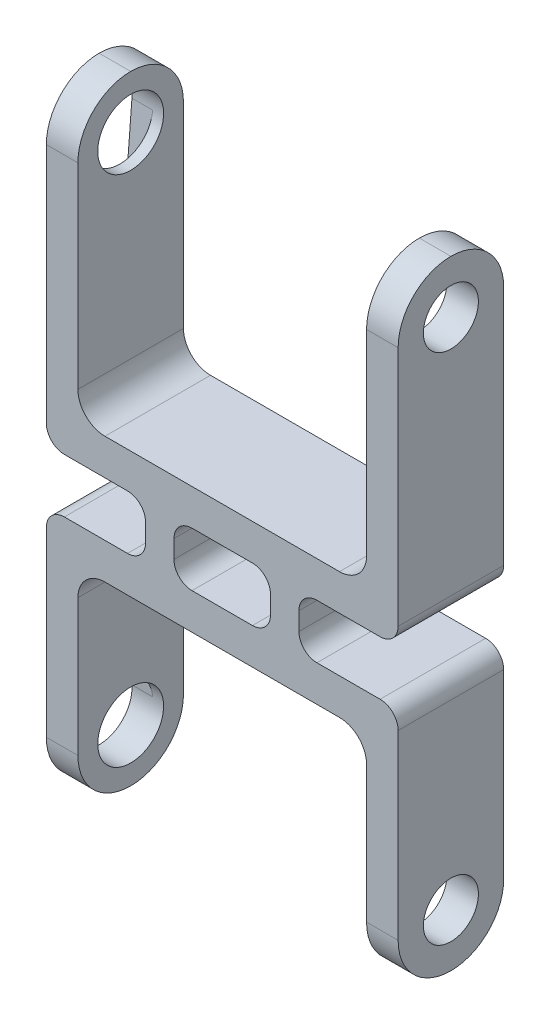
from build123d import *

# Parameters (mm, degrees)
SKETCH_1_W          = 10.7
SKETCH_1_H          = 6
EXTRUDE_1_DEPTH     = 11.7
SKETCH_2_R          = 3.65
CUT_EXTRUDE_1_DEPTH = 18.7
CUT_EXTRUDE_2_DEPTH = 2.3
SKETCH_2_4_R        = 3.65
CUT_EXTRUDE_3_DEPTH = 15.3
CUT_EXTRUDE_4_DEPTH = 2.3
FILLET_1_R          = 2
FILLET_2_R          = 2
FILLET_3_R          = 2
FILLET_4_R          = 2
FILLET_5_R          = 5.85
FILLET_6_R          = 5.85
FILLET_7_R          = 5.85
FILLET_8_R          = 5.85
FILLET_9_R          = 5.85
FILLET_10_R         = 5.85
FILLET_11_R         = 5.85
FILLET_12_R         = 5.85
FILLET_13_R         = 2
FILLET_14_R         = 2
FILLET_15_R         = 2
FILLET_16_R         = 2
FILLET_17_R         = 2
FILLET_18_R         = 2
FILLET_19_R         = 2
FILLET_20_R         = 2
SKETCH_3_R          = 3.05
CUT_EXTRUDE_5_DEPTH = 10
FILLET_21_R         = 3
FILLET_22_R         = 3
FILLET_23_R         = 3
FILLET_24_R         = 3


with BuildPart() as part:
    # 草图1 → 凸台-拉伸1 (new body)
    with BuildSketch(Plane.XY):
        Polygon((0, 0), (0, -28), (3.5, -28), (3.5, -4), (35.5, -4), (35.5, -28), (39, -28), (39, 0), (28, 0), (28, 6), (39, 6), (39, 40.6), (35.5, 40.6), (35.5, 10), (3.5, 10), (3.5, 40.6), (0, 40.6), (0, 6), (11, 6), (11, 0), align=None)
        with Locations((19.5, 3)):
            Rectangle(SKETCH_1_W, SKETCH_1_H, mode=Mode.SUBTRACT)
    extrude(amount=EXTRUDE_1_DEPTH)

    # 草图2 → 切除-拉伸1 (cut)
    with BuildSketch(Plane.ZY):
        with Locations(Location((5.85, -22.15, 0), (0, 0, 270))):
            Circle(SKETCH_2_R)
    extrude(amount=-CUT_EXTRUDE_1_DEPTH, mode=Mode.SUBTRACT)

    # 草图2<3> → 切除-拉伸2 (cut)
    with BuildSketch(Plane.ZY):
        with BuildLine():
            ThreePointArc((8.242618438, -6.011912226), (5.85, -3.8), (3.457381562, -6.011912226))
            Line((3.457381562, -6.011912226), (2.211226126, -21.863949843))
            ThreePointArc((2.211226126, -21.863949843), (5.85, -18.5), (9.488773874, -21.863949843))
            Line((9.488773874, -21.863949843), (8.242618438, -6.011912226))
        make_face()
    extrude(amount=-CUT_EXTRUDE_2_DEPTH, mode=Mode.SUBTRACT)

    # 草图2<4> → 切除-拉伸3 (cut)
    with BuildSketch(Plane.ZY):
        with Locations(Location((5.85, 34.75, 0), (0, 0, 270))):
            Circle(SKETCH_2_4_R)
    extrude(amount=-CUT_EXTRUDE_3_DEPTH, mode=Mode.SUBTRACT)

    # 草图2<5> → 切除-拉伸4 (cut)
    with BuildSketch(Plane.ZY):
        with BuildLine():
            Line((2.211226126, 34.463949843), (3.457381562, 18.611912226))
            ThreePointArc((3.457381562, 18.611912226), (5.85, 16.4), (8.242618438, 18.611912226))
            Line((8.242618438, 18.611912226), (9.488773874, 34.463949843))
            ThreePointArc((9.488773874, 34.463949843), (5.85, 31.1), (2.211226126, 34.463949843))
        make_face()
    extrude(amount=-CUT_EXTRUDE_4_DEPTH, mode=Mode.SUBTRACT)

    # 圆角1
    fillet_1_edges = [part.edges().sort_by_distance(p)[0] for p in [
        (0, 6, 5.85),
    ]]
    fillet(fillet_1_edges, radius=FILLET_1_R)

    # 圆角2
    fillet_2_edges = [part.edges().sort_by_distance(p)[0] for p in [
        (39, 6, 5.85),
    ]]
    fillet(fillet_2_edges, radius=FILLET_2_R)

    # 圆角3
    fillet_3_edges = [part.edges().sort_by_distance(p)[0] for p in [
        (39, 0, 5.85),
    ]]
    fillet(fillet_3_edges, radius=FILLET_3_R)

    # 圆角4
    fillet_4_edges = [part.edges().sort_by_distance(p)[0] for p in [
        (0, 0, 5.85),
    ]]
    fillet(fillet_4_edges, radius=FILLET_4_R)

    # 圆角5
    fillet_5_edges = [part.edges().sort_by_distance(p)[0] for p in [
        (1.75, -28, 11.7),
    ]]
    fillet(fillet_5_edges, radius=FILLET_5_R)

    # 圆角6
    fillet_6_edges = [part.edges().sort_by_distance(p)[0] for p in [
        (1.75, -28, 0),
    ]]
    fillet(fillet_6_edges, radius=FILLET_6_R - 0.0001)  # a hair under: the kernel refuses the full size

    # 圆角7
    fillet_7_edges = [part.edges().sort_by_distance(p)[0] for p in [
        (37.25, -28, 0),
    ]]
    fillet(fillet_7_edges, radius=FILLET_7_R)

    # 圆角8
    fillet_8_edges = [part.edges().sort_by_distance(p)[0] for p in [
        (37.25, -28, 11.7),
    ]]
    fillet(fillet_8_edges, radius=FILLET_8_R - 0.0001)  # a hair under: the kernel refuses the full size

    # 圆角9
    fillet_9_edges = [part.edges().sort_by_distance(p)[0] for p in [
        (37.25, 40.6, 11.7),
    ]]
    fillet(fillet_9_edges, radius=FILLET_9_R)

    # 圆角10
    fillet_10_edges = [part.edges().sort_by_distance(p)[0] for p in [
        (37.25, 40.6, 0),
    ]]
    fillet(fillet_10_edges, radius=FILLET_10_R - 0.0001)  # a hair under: the kernel refuses the full size

    # 圆角11
    fillet_11_edges = [part.edges().sort_by_distance(p)[0] for p in [
        (1.75, 40.6, 0),
    ]]
    fillet(fillet_11_edges, radius=FILLET_11_R)

    # 圆角12
    fillet_12_edges = [part.edges().sort_by_distance(p)[0] for p in [
        (1.75, 40.6, 11.7),
    ]]
    fillet(fillet_12_edges, radius=FILLET_12_R - 0.0001)  # a hair under: the kernel refuses the full size

    # 圆角13
    fillet_13_edges = [part.edges().sort_by_distance(p)[0] for p in [
        (28, 6, 5.85),
    ]]
    fillet(fillet_13_edges, radius=FILLET_13_R)

    # 圆角14
    fillet_14_edges = [part.edges().sort_by_distance(p)[0] for p in [
        (28, 0, 5.85),
    ]]
    fillet(fillet_14_edges, radius=FILLET_14_R)

    # 圆角15
    fillet_15_edges = [part.edges().sort_by_distance(p)[0] for p in [
        (11, 6, 5.85),
    ]]
    fillet(fillet_15_edges, radius=FILLET_15_R)

    # 圆角16
    fillet_16_edges = [part.edges().sort_by_distance(p)[0] for p in [
        (11, 0, 5.85),
    ]]
    fillet(fillet_16_edges, radius=FILLET_16_R)

    # 圆角17
    fillet_17_edges = [part.edges().sort_by_distance(p)[0] for p in [
        (24.85, 6, 5.85),
    ]]
    fillet(fillet_17_edges, radius=FILLET_17_R)

    # 圆角18
    fillet_18_edges = [part.edges().sort_by_distance(p)[0] for p in [
        (24.85, 0, 5.85),
    ]]
    fillet(fillet_18_edges, radius=FILLET_18_R)

    # 圆角19
    fillet_19_edges = [part.edges().sort_by_distance(p)[0] for p in [
        (14.15, 6, 5.85),
    ]]
    fillet(fillet_19_edges, radius=FILLET_19_R)

    # 圆角20
    fillet_20_edges = [part.edges().sort_by_distance(p)[0] for p in [
        (14.15, 0, 5.85),
    ]]
    fillet(fillet_20_edges, radius=FILLET_20_R)

    # 草图3 → 切除-拉伸5 (cut)
    with BuildSketch(Plane(origin=(39, 0, 0), x_dir=(0, 0, -1), z_dir=(1, 0, 0))):
        with Locations((-5.85, 34.75)):
            Circle(SKETCH_3_R)
        with Locations((-5.85, -22.15)):
            Circle(SKETCH_3_R)
    extrude(amount=-CUT_EXTRUDE_5_DEPTH, mode=Mode.SUBTRACT)

    # 圆角21
    fillet_21_edges = [part.edges().sort_by_distance(p)[0] for p in [
        (3.5, -4, 5.85),
    ]]
    fillet(fillet_21_edges, radius=FILLET_21_R)

    # 圆角22
    fillet_22_edges = [part.edges().sort_by_distance(p)[0] for p in [
        (35.5, -4, 5.85),
    ]]
    fillet(fillet_22_edges, radius=FILLET_22_R)

    # 圆角23
    fillet_23_edges = [part.edges().sort_by_distance(p)[0] for p in [
        (35.5, 10, 5.85),
    ]]
    fillet(fillet_23_edges, radius=FILLET_23_R)

    # 圆角24
    fillet_24_edges = [part.edges().sort_by_distance(p)[0] for p in [
        (3.5, 10, 5.85),
    ]]
    fillet(fillet_24_edges, radius=FILLET_24_R)


solid = part.part
